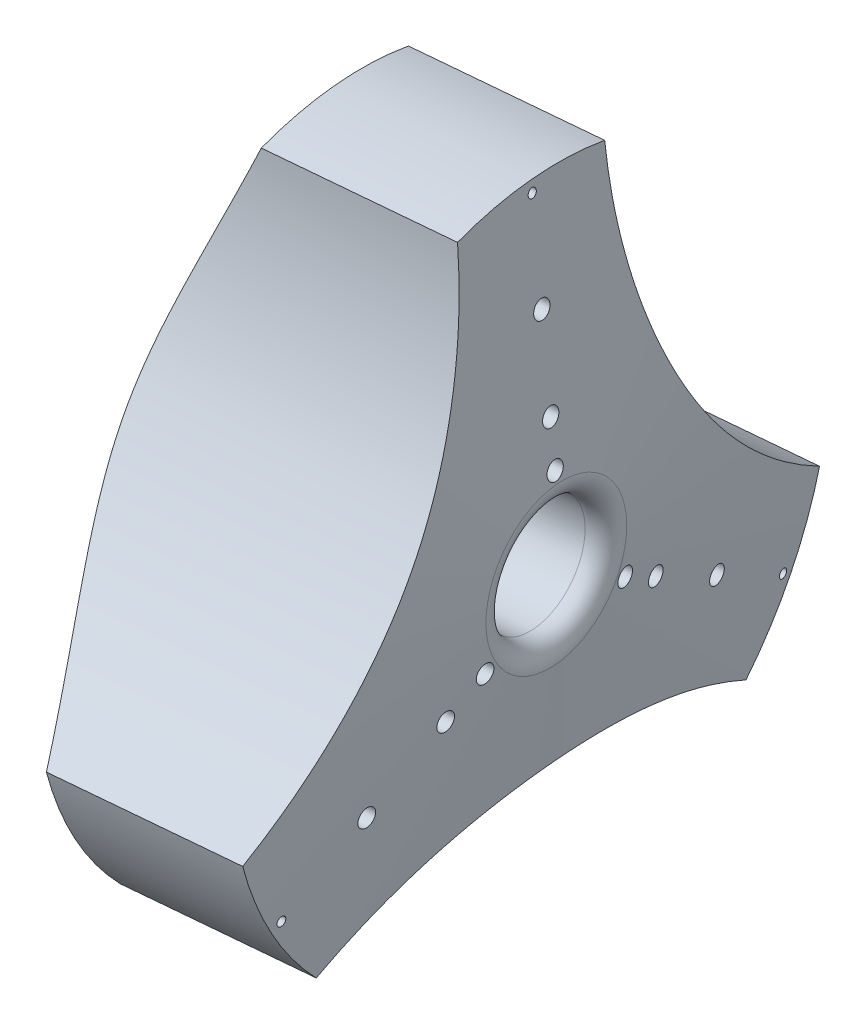
from build123d import *

# Parameters (mm, degrees)
SKETCH_2_R               = 2
SKETCH_2_R_2             = 1
SKETCH_2_R_3             = 110
SKETCH_2_R_4             = 12.5
CUT_EXTRUDE_1_DEPTH      = 105
FILLET_1_R               = 4.5
SHELL_1_T                = 2
SKETCH_3_W               = 64.961977346
SKETCH_3_H               = 2.669498791
EXTRUDE_1_DEPTH          = 0.5
PATTERN_CIRCULAR_1_COUNT = 3


with BuildPart() as part:
    # 草图1 → 旋转1 (revolve)
    with BuildSketch(Plane(origin=(0, 0, 0), x_dir=(1, 0, 0), z_dir=(0, 1, 0))):
        Polygon((-75.535900319, 130.832019173), (-40.22597836, 69.673439381), (0, 73.35401488), (0, 137.743383171), align=None)
    revolve(axis=Axis((-81.042620617, 0, -140.369938659), (0.9958401828273251, 0, -0.09111712389249231)))

    # 草图2 → 切除-拉伸1 (cut)
    with BuildSketch(Plane(origin=(12.498571956, 0, -1.143591059), x_dir=(-0.09111712389249245, 0, -0.9958401828273251), z_dir=(0.995840182827325, 0, -0.09111712389249244))):
        with Locations((147.170395881, 20)):
            Circle(SKETCH_2_R)
        with Locations((147.170395881, 30)):
            Circle(SKETCH_2_R)
        with Locations((147.170395881, 50)):
            Circle(SKETCH_2_R)
        with Locations((147.170395881, 71.621520292)):
            Circle(SKETCH_2_R_2)
        with Locations((18.998636121, 74)):
            Circle(SKETCH_2_R_3)
        with Locations((275.342155641, 74)):
            Circle(SKETCH_2_R_3)
        with Locations((209.196451911, -35.810760146)):
            Circle(SKETCH_2_R_2)
        with Locations((190.47166607, -25)):
            Circle(SKETCH_2_R)
        with Locations((173.151157994, -15)):
            Circle(SKETCH_2_R)
        with Locations((164.490903956, -10)):
            Circle(SKETCH_2_R)
        with Locations((147.170395881, -148)):
            Circle(SKETCH_2_R_3)
        with Locations((85.14433985, -35.810760146)):
            Circle(SKETCH_2_R_2)
        with Locations((103.869125691, -25)):
            Circle(SKETCH_2_R)
        with Locations((121.189633767, -15)):
            Circle(SKETCH_2_R)
        with Locations((129.849887805, -10)):
            Circle(SKETCH_2_R)
        with Locations((147.170395881, 0)):
            Circle(SKETCH_2_R_4)
    extrude(amount=-CUT_EXTRUDE_1_DEPTH, mode=Mode.SUBTRACT)

    # 圆角1
    fillet_1_edges = [part.edges().sort_by_distance(p)[0] for p in [
        (-1.138964049, -12.5, -147.680942473),
    ]]
    fillet(fillet_1_edges, radius=FILLET_1_R)

    # 抽壳1 (no face opened: a closed hollow body)
    add(offset(amount=-SHELL_1_T, mode=Mode.PRIVATE), mode=Mode.SUBTRACT)

    # 草图3 → 凸台-拉伸1 (add, symmetric)
    with BuildSketch(Plane(origin=(-13.409743195, 0, -146.558193941), x_dir=(-0.9958401828273251, 0, 0.09111712389249245), z_dir=(-0.09111712389249244, -1.4005114063894313e-15, -0.995840182827325))):
        Polygon((-10.380296147, 16.466259597), (58.670395037, 16.466259597), (59.782183763, 14.036795344), (-10.105181002, 14.036795344), (-10.941076118, 15.863380968), align=None)
        with Locations((22.538700016, 25.032147565)):
            Rectangle(SKETCH_3_W, SKETCH_3_H)
        Polygon((-5.649088472, 69.193697161), (34.432870104, 69.193697161), (41.598582445, 53.535288712), (-7.078544912, 53.535288712), align=None)
    extrude_1 = extrude(amount=EXTRUDE_1_DEPTH, both=True)

    # 阵列(圆周)1: 凸台-拉伸1 ×3 about axis
    pattern_circular_1_axis = Axis((-74.732313436, 0, -140.94731749), (0.9958401828273251, 0, -0.09111712389249273))
    for i in range(1, PATTERN_CIRCULAR_1_COUNT):
        add(extrude_1.rotate(pattern_circular_1_axis, i * 360 / PATTERN_CIRCULAR_1_COUNT))


solid = part.part
